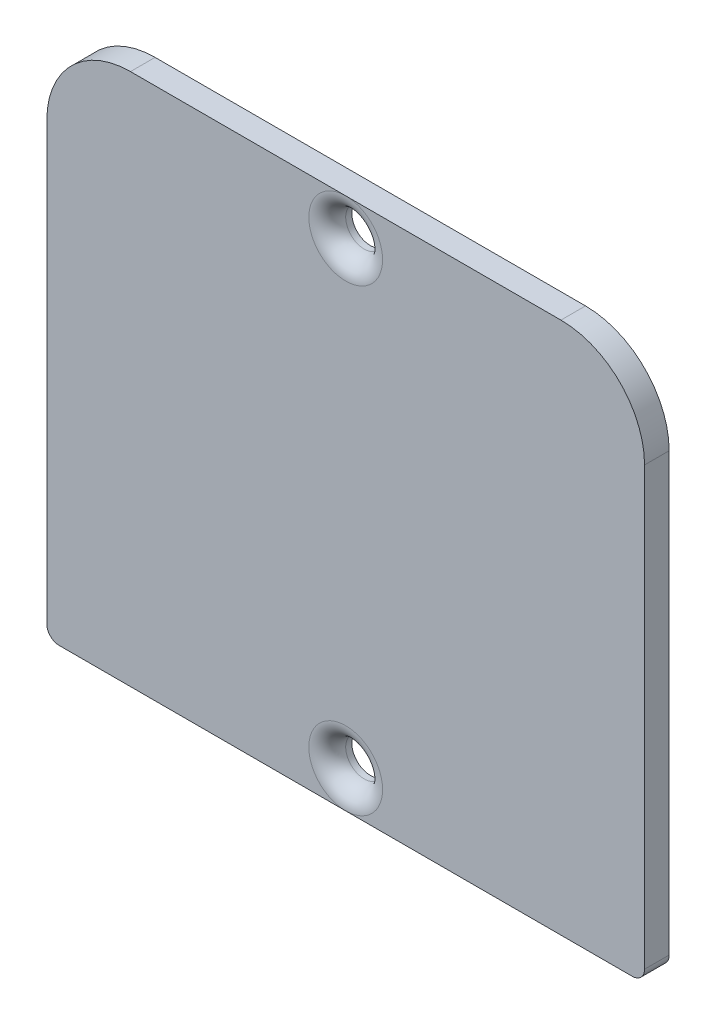
from build123d import *

# Parameters (mm, degrees)
SKIZZE2_W                       = 48.6
SKIZZE2_H                       = 43.31
AUFSATZ_LINEAR_AUSTRAGEN1_DEPTH = 2
VERRUNDUNG1_R                   = 6.8
VERRUNDUNG2_R                   = 1
SKIZZE4_R                       = 1.5
SCHNITT_LINEAR_AUSTRAGEN1_DEPTH = 11
VERRUNDUNG3_R                   = 1.5
VERRUNDUNG4_R                   = 1.5


with BuildPart() as part:
    # Skizze2 → Aufsatz-Linear austragen1 (new body)
    with BuildSketch(Plane.XY):
        with Locations((-2.463944442, 5.680169492)):
            Rectangle(SKIZZE2_W, SKIZZE2_H)
    extrude(amount=AUFSATZ_LINEAR_AUSTRAGEN1_DEPTH)

    # Verrundung1
    verrundung1_edges = [part.edges().sort_by_distance(p)[0] for p in [
        (-26.763944442, 27.335169492, 1),
        (21.836055558, 27.335169492, 1),
    ]]
    fillet(verrundung1_edges, radius=VERRUNDUNG1_R)

    # Verrundung2
    verrundung2_edges = [part.edges().sort_by_distance(p)[0] for p in [
        (21.836055558, -15.974830508, 1),
        (-26.763944442, -15.974830508, 1),
    ]]
    fillet(verrundung2_edges, radius=VERRUNDUNG2_R)

    # Skizze4 → Schnitt-Linear austragen1 (cut)
    with BuildSketch(Plane.XY.offset(2)):
        with Locations((-2.463944442, 24.335169492)):
            Circle(SKIZZE4_R)
        with Locations((-2.463944442, -12.974830508)):
            Circle(SKIZZE4_R)
    extrude(amount=-SCHNITT_LINEAR_AUSTRAGEN1_DEPTH, mode=Mode.SUBTRACT)

    # Verrundung3
    verrundung3_edges = [part.edges().sort_by_distance(p)[0] for p in [
        (-3.963944442, 24.335169492, 2),
    ]]
    fillet(verrundung3_edges, radius=VERRUNDUNG3_R - 0.0001)  # a hair under: the kernel refuses the full size

    # Verrundung4
    verrundung4_edges = [part.edges().sort_by_distance(p)[0] for p in [
        (-3.963944442, -12.974830508, 2),
    ]]
    fillet(verrundung4_edges, radius=VERRUNDUNG4_R - 0.0001)  # a hair under: the kernel refuses the full size


solid = part.part
